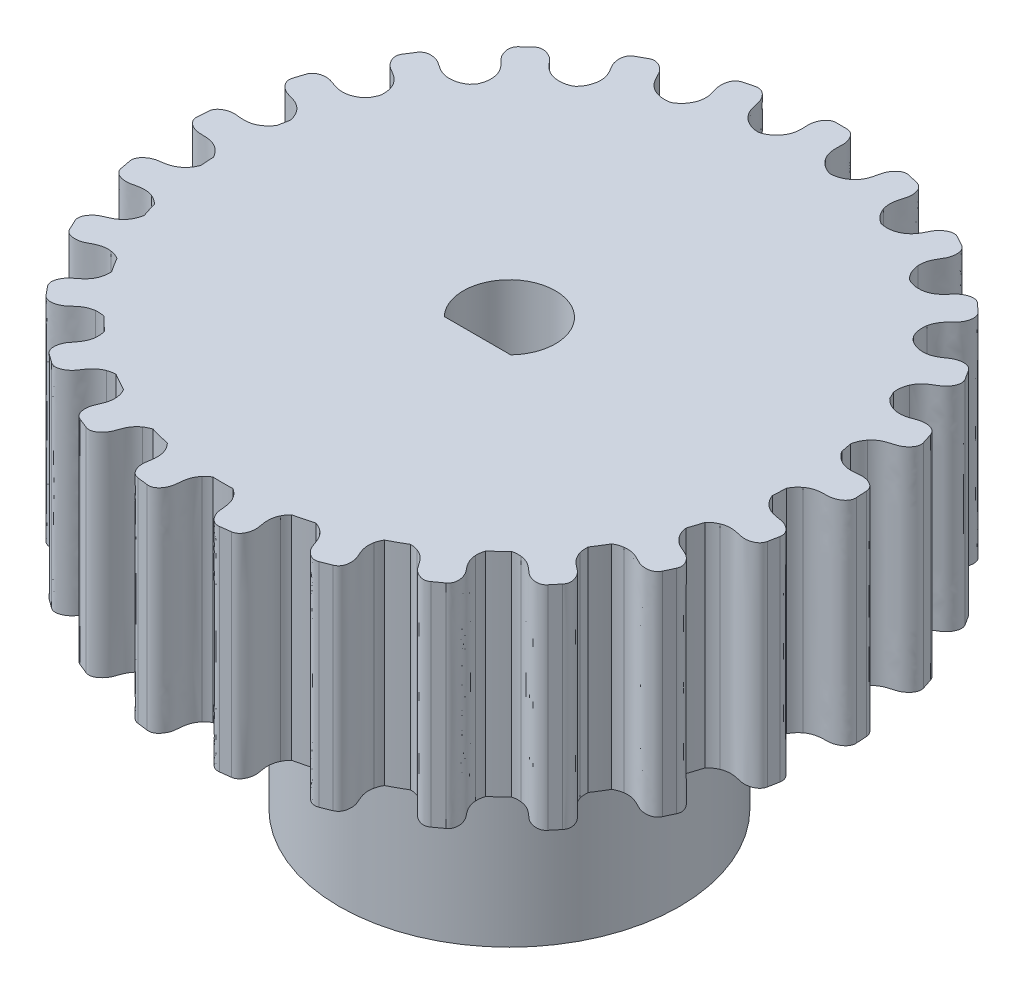
from build123d import *

# Parameters (mm, degrees)
SKETCH1_R           = 17.125
BOSS_EXTRUDE1_DEPTH = 12.7
BOSS_EXTRUDE2_START = -12.7
BOSS_EXTRUDE2_DEPTH = 12.7
CIRPATTERN1_DEPTH   = 12.7
SKETCH3_R           = 10.16
BOSS_EXTRUDE3_DEPTH = 12.7
CUT_EXTRUDE1_DEPTH  = 25.4


# Read off the part's stored shape, not the designer's step: CirPattern1
with BuildPart() as part:
    # Sketch1 → Boss-Extrude1 (new body)
    with BuildSketch(Plane(origin=(0, 0, 0), x_dir=(1, 0, 0), z_dir=(0, 1, 0))):
        with Locations(Location((0, 0, 0), (0, 0, 270))):
            Circle(SKETCH1_R)
    extrude(amount=BOSS_EXTRUDE1_DEPTH)

    # Sketch2 → Boss-Extrude2 (add)
    with BuildSketch(Plane(origin=(0, 12.7, 0), x_dir=(1, 0, 0), z_dir=(0, 1, 0)).offset(BOSS_EXTRUDE2_START)):
        with BuildLine():
            Line((-0.3175, 19.825), (0.3175, 19.825))
            add(Edge.make_bspline(
                [(0.3175, 19.825), (0.607981993, 19.825), (0.89165993, 19.520095158), (1.061805109, 18.955823633), (0.968587789, 18.338125341), (1.094815852, 17.865838386), (1.25, 17.633)],
                knots=[0, 0, 0, 0, 0.24204592, 0.376938714, 0.592012562, 0.861996226, 0.861996226, 0.861996226, 0.861996226], degree=3))
            ThreePointArc((1.25, 17.633), (1.709680567, 17.18632638), (2.312365192, 16.968164079))
            ThreePointArc((2.312365192, 16.968164079), (0, 17.125), (-2.312365192, 16.968164079))
            ThreePointArc((-2.312365192, 16.968164079), (-1.709680567, 17.18632638), (-1.25, 17.633))
            add(Edge.make_bspline(
                [(-0.3175, 19.825), (-0.610981756, 19.825), (-0.890921324, 19.520095158), (-1.062056245, 18.955823633), (-0.96847928, 18.338125341), (-1.094815852, 17.865838386), (-1.25, 17.633)],
                knots=[0, 0, 0, 0, 0.24204592, 0.376938714, 0.592012562, 0.861996226, 0.861996226, 0.861996226, 0.861996226], degree=3))
        make_face()
    extrude(amount=BOSS_EXTRUDE2_DEPTH)

    # CirPattern1 outline → CirPattern1 (add)
    with BuildSketch(Plane(origin=(0, 0, 0), x_dir=(1, 0, 0), z_dir=(0, 1, 0))):
        with BuildLine():
            ThreePointArc((-2.133196695, 17.003626255), (-2.675042221, 17.105543819), (-3.145165664, 17.393584983))
            add(Edge.make_bspline(
                [(-3.145165664, 17.393584983), (-3.353378968, 17.580515595), (-3.593094334, 18.006573144), (-3.656420926, 18.628047513), (-3.961549303, 19.132278025), (-4.312141727, 19.357055886), (-4.593497694, 19.284815952)],
                knots=[0, 0, 0, 0, 0.269983664, 0.485057513, 0.619950306, 0.861996226, 0.861996226, 0.861996226, 0.861996226], degree=3))
            Line((-4.593497694, 19.284815952), (-5.208548001, 19.126897874))
            add(Edge.make_bspline(
                [(-5.208548001, 19.126897874), (-5.492809488, 19.053911929), (-5.688127489, 18.688968094), (-5.71355727, 18.099864672), (-5.469304879, 17.524844153), (-5.474219366, 17.035976333), (-5.566623566, 16.771860265)],
                knots=[0, 0, 0, 0, 0.24204592, 0.376938714, 0.592012562, 0.861996226, 0.861996226, 0.861996226, 0.861996226], degree=3))
            ThreePointArc((-5.566623566, 16.771860265), (-5.839830786, 16.292964416), (-6.265554128, 15.942617366))
            ThreePointArc((-6.265554128, 15.942617366), (-6.815722447, 15.9065815), (-7.342709022, 16.068658375))
            add(Edge.make_bspline(
                [(-7.342709022, 16.068658375), (-7.590868676, 16.197935675), (-7.929009146, 16.550993056), (-8.144900608, 17.137193981), (-8.565839845, 17.549700823), (-8.961317744, 17.680228084), (-9.215869055, 17.540287317)],
                knots=[0, 0, 0, 0, 0.269983664, 0.485057513, 0.619950306, 0.861996226, 0.861996226, 0.861996226, 0.861996226], degree=3))
            Line((-9.215869055, 17.540287317), (-9.772323797, 17.234373734))
            add(Edge.make_bspline(
                [(-9.772323797, 17.234373734), (-10.02950382, 17.09298782), (-10.127927706, 16.690935754), (-10.006054499, 16.114015971), (-9.626473958, 15.617803878), (-9.509657565, 15.143072557), (-9.533475722, 14.86427419)],
                knots=[0, 0, 0, 0, 0.24204592, 0.376938714, 0.592012562, 0.861996226, 0.861996226, 0.861996226, 0.861996226], degree=3))
            ThreePointArc((-9.533475722, 14.86427419), (-9.6659888, 14.360198934), (-9.960605101, 13.930253803))
            ThreePointArc((-9.960605101, 13.930253803), (-6.321682898, 15.915462617), (-2.312365192, 16.968164079))
            ThreePointArc((-2.312365192, 16.968164079), (-2.222249219, 16.98320869), (-2.133196695, 17.003626255))
        make_face()
        with BuildLine():
            ThreePointArc((2.312365192, 16.968164079), (6.321682164, 15.915462909), (9.960603816, 13.930254722))
            ThreePointArc((9.960603816, 13.930254722), (9.665988361, 14.360199402), (9.533475641, 14.864273874))
            add(Edge.make_bspline(
                [(9.533475641, 14.864273874), (9.509657483, 15.143072241), (9.626568965, 15.617751287), (10.005834346, 16.114136641), (10.12857487, 16.690579612), (10.026875026, 17.09443265), (9.772323716, 17.234373418)],
                knots=[0, 0, 0, 0, 0.269983664, 0.485057513, 0.619950306, 0.861996226, 0.861996226, 0.861996226, 0.861996226], degree=3))
            Line((9.772323716, 17.234373418), (9.215868974, 17.540287001))
            add(Edge.make_bspline(
                [(9.215868974, 17.540287001), (8.958688951, 17.681672915), (8.566487009, 17.54934468), (8.144680455, 17.137314651), (7.929104153, 16.550940465), (7.590868595, 16.197935359), (7.342708941, 16.068658059)],
                knots=[0, 0, 0, 0, 0.24204592, 0.376938714, 0.592012562, 0.861996226, 0.861996226, 0.861996226, 0.861996226], degree=3))
            ThreePointArc((7.342708941, 16.068658059), (6.815722682, 15.906581221), (6.265554663, 15.942616894))
            ThreePointArc((6.265554663, 15.942616894), (5.839830971, 16.292964009), (5.566623546, 16.771860101))
            add(Edge.make_bspline(
                [(5.566623546, 16.771860101), (5.474219345, 17.03597617), (5.469409959, 17.524817004), (5.713314003, 18.099926964), (5.68884287, 18.688784246), (5.489903947, 19.054657776), (5.208547981, 19.12689771)],
                knots=[0, 0, 0, 0, 0.269983664, 0.485057513, 0.619950306, 0.861996226, 0.861996226, 0.861996226, 0.861996226], degree=3))
            Line((5.208547981, 19.12689771), (4.593497673, 19.284815789))
            add(Edge.make_bspline(
                [(4.593497673, 19.284815789), (4.309236187, 19.357801733), (3.962264684, 19.132094177), (3.65617766, 18.628109805), (3.593199414, 18.006545995), (3.353378948, 17.580515431), (3.145165643, 17.393584819)],
                knots=[0, 0, 0, 0, 0.24204592, 0.376938714, 0.592012562, 0.861996226, 0.861996226, 0.861996226, 0.861996226], degree=3))
            ThreePointArc((3.145165643, 17.393584819), (2.675042497, 17.10554377), (2.13319731, 17.003626094))
            ThreePointArc((2.13319731, 17.003626094), (2.222249531, 16.983208629), (2.312365192, 16.968164079))
        make_face()
        with BuildLine():
            ThreePointArc((10.061175389, 13.857791122), (11.63148023, 12.568782465), (13.038084403, 11.102881612))
            ThreePointArc((13.038084403, 11.102881612), (12.896645059, 11.555715834), (12.901304379, 12.030101975))
            add(Edge.make_bspline(
                [(12.901304379, 12.030101975), (12.947568847, 12.306064714), (13.178855218, 12.736756142), (13.669651298, 13.123227172), (13.93189124, 13.6510358), (13.93382065, 14.067492775), (13.722068391, 14.266341383)],
                knots=[0, 0, 0, 0, 0.269983664, 0.485057513, 0.619950306, 0.861996226, 0.861996226, 0.861996226, 0.861996226], degree=3))
            Line((13.722068391, 14.266341383), (13.259173312, 14.701028795))
            add(Edge.make_bspline(
                [(13.259173312, 14.701028795), (13.045234319, 14.901930882), (12.632445429, 14.871296639), (12.121423002, 14.577110315), (11.766794096, 14.062769798), (11.35139603, 13.80497076), (11.078882811, 13.74146974)],
                knots=[0, 0, 0, 0, 0.24204592, 0.376938714, 0.592012562, 0.861996226, 0.861996226, 0.861996226, 0.861996226], degree=3))
            ThreePointArc((11.078882811, 13.74146974), (10.559963423, 13.711564817), (10.061175389, 13.857791122))
        make_face()
        with BuildLine():
            ThreePointArc((13.239263858, 10.862205923), (14.384473987, 9.292606368), (15.344515696, 7.603384974))
            ThreePointArc((15.344515696, 7.603384974), (15.34134542, 8.033529646), (15.458496695, 8.44742585))
            add(Edge.make_bspline(
                [(15.458496695, 8.44742585), (15.571936822, 8.703213206), (15.903065509, 9.062855089), (16.474553764, 9.3151284), (16.859815624, 9.761138528), (16.965253057, 10.164031917), (16.809605022, 10.409293975)],
                knots=[0, 0, 0, 0, 0.269983664, 0.485057513, 0.619950306, 0.861996226, 0.861996226, 0.861996226, 0.861996226], degree=3))
            Line((16.809605022, 10.409293975), (16.469355007, 10.945442208))
            add(Edge.make_bspline(
                [(16.469355007, 10.945442208), (16.312099618, 11.19323705), (15.904660824, 11.26622166), (15.336531942, 11.10836385), (14.86513307, 10.698374909), (14.398673484, 10.5519804), (14.118929708, 10.558245664)],
                knots=[0, 0, 0, 0, 0.24204592, 0.376938714, 0.592012562, 0.861996226, 0.861996226, 0.861996226, 0.861996226], degree=3))
            ThreePointArc((14.118929708, 10.558245664), (13.655325725, 10.641431971), (13.239263858, 10.862205923))
        make_face()
        with BuildLine():
            ThreePointArc((15.555546224, 7.161746062), (16.241216742, 5.430331825), (16.734830812, 3.634702558))
            ThreePointArc((16.734830812, 3.634702558), (16.84414735, 4.007941727), (17.044374791, 4.341358214))
            add(Edge.make_bspline(
                [(17.044374791, 4.341358214), (17.217862716, 4.560898128), (17.628027686, 4.826892845), (18.244299408, 4.929117175), (18.728375767, 5.265304346), (18.9306962, 5.629318875), (18.840932327, 5.905583667)],
                knots=[0, 0, 0, 0, 0.269983664, 0.485057513, 0.619950306, 0.861996226, 0.861996226, 0.861996226, 0.861996226], degree=3))
            Line((18.840932327, 5.905583667), (18.644706536, 6.509504555))
            add(Edge.make_bspline(
                [(18.644706536, 6.509504555), (18.554015686, 6.788622291), (18.177527865, 6.960639864), (17.587990156, 6.949029355), (17.029441043, 6.669153103), (16.541229309, 6.643361628), (16.271832305, 6.718999505)],
                knots=[0, 0, 0, 0, 0.24204592, 0.376938714, 0.592012562, 0.861996226, 0.861996226, 0.861996226, 0.861996226], degree=3))
            ThreePointArc((16.271832305, 6.718999505), (15.882502828, 6.889918612), (15.555546224, 7.161746062))
        make_face()
        with BuildLine():
            ThreePointArc((16.860605941, 2.997597754), (17.081410447, 1.221082366), (17.115551932, -0.568776821))
            ThreePointArc((17.115551932, -0.568776821), (17.306171434, -0.273696163), (17.559292113, -0.0301016))
            add(Edge.make_bspline(
                [(17.559292113, -0.0301016), (17.781926953, 0.13939637), (18.245356032, 0.295030494), (18.867688601, 0.240782714), (19.420163161, 0.446023052), (19.706654057, 0.74828635), (19.688414542, 1.038195143)],
                knots=[0, 0, 0, 0, 0.269983664, 0.485057513, 0.619950306, 0.861996226, 0.861996226, 0.861996226, 0.861996226], degree=3))
            Line((19.688414542, 1.038195143), (19.648542562, 1.671942115))
            add(Edge.make_bspline(
                [(19.648542562, 1.671942115), (19.63011469, 1.964844752), (19.308233958, 2.22508679), (18.734330243, 2.360453112), (18.123726584, 2.228275203), (17.64443884, 2.324707336), (17.402315814, 2.464965221)],
                knots=[0, 0, 0, 0, 0.24204592, 0.376938714, 0.592012562, 0.861996226, 0.861996226, 0.861996226, 0.861996226], degree=3))
            ThreePointArc((17.402315814, 2.464965221), (17.097739623, 2.696985541), (16.860605941, 2.997597754))
        make_face()
        with BuildLine():
            ThreePointArc((17.070991058, -1.359003049), (16.847212798, -3.071977529), (16.451992286, -4.753690652))
            ThreePointArc((16.451992286, -4.753690652), (16.692491971, -4.545774899), (16.970894512, -4.392278697))
            add(Edge.make_bspline(
                [(16.970894512, -4.392278697), (17.2286873, -4.28347285), (17.716261535, -4.247978384), (18.305551509, -4.455289686), (18.89171026, -4.393892187), (19.244370344, -4.172372436), (19.298801242, -3.887035678)],
                knots=[0, 0, 0, 0, 0.269983664, 0.485057513, 0.619950306, 0.861996226, 0.861996226, 0.861996226, 0.861996226], degree=3))
            Line((19.298801242, -3.887035678), (19.417788377, -3.263283273))
            add(Edge.make_bspline(
                [(19.417788377, -3.263283273), (19.472781374, -2.974999886), (19.225732679, -2.642885347), (18.703523441, -2.369047757), (18.079231709, -2.345222098), (17.638983368, -2.132625544), (17.439347799, -1.936560571)],
                knots=[0, 0, 0, 0, 0.24204592, 0.376938714, 0.592012562, 0.861996226, 0.861996226, 0.861996226, 0.861996226], degree=3))
            ThreePointArc((17.439347799, -1.936560571), (17.22229806, -1.668746631), (17.070991058, -1.359003049))
        make_face()
        with BuildLine():
            ThreePointArc((16.174934263, -5.624689021), (15.548144412, -7.177801219), (14.772639883, -8.662259282))
            ThreePointArc((14.772639883, -8.662259282), (15.035279882, -8.540751989), (15.316153174, -8.471081446))
            add(Edge.make_bspline(
                [(15.316153174, -8.471081446), (15.592905842, -8.429804394), (16.07398915, -8.516679834), (16.593209271, -8.864028527), (17.176221705, -8.950331697), (17.572892046, -8.823474392), (17.696573263, -8.560638427)],
                knots=[0, 0, 0, 0, 0.269983664, 0.485057513, 0.619950306, 0.861996226, 0.861996226, 0.861996226, 0.861996226], degree=3))
            Line((17.696573263, -8.560638427), (17.966943113, -7.986073249))
            add(Edge.make_bspline(
                [(17.966943113, -7.986073249), (18.091901567, -7.720523017), (17.935207889, -7.337403955), (17.497505453, -6.942301319), (16.898752195, -6.763969147), (16.525205677, -6.448566394), (16.380601403, -6.209013815)],
                knots=[0, 0, 0, 0, 0.24204592, 0.376938714, 0.592012562, 0.861996226, 0.861996226, 0.861996226, 0.861996226], degree=3))
            ThreePointArc((16.380601403, -6.209013815), (16.247765815, -5.927411348), (16.174934263, -5.624689021))
        make_face()
        with BuildLine():
            ThreePointArc((14.233148824, -9.522767431), (13.261769633, -10.834716942), (12.169885972, -12.048215653))
            ThreePointArc((12.169885972, -12.048215653), (12.432797896, -12.006017119), (12.699041583, -12.01022367))
            add(Edge.make_bspline(
                [(12.699041583, -12.01022367), (12.977364742, -12.039069002), (13.42172889, -12.242855643), (13.838254649, -12.708416532), (14.381487949, -12.936997626), (14.797244291, -12.912773679), (14.982404481, -12.688953457)],
                knots=[0, 0, 0, 0, 0.269983664, 0.485057513, 0.619950306, 0.861996226, 0.861996226, 0.861996226, 0.861996226], degree=3))
            Line((14.982404481, -12.688953457), (15.387168715, -12.199677548))
            add(Edge.make_bspline(
                [(15.387168715, -12.199677548), (15.574241027, -11.973545968), (15.517748005, -11.563495163), (15.192054826, -11.071953234), (14.65646191, -10.750319815), (14.373088518, -10.351928777), (14.292601557, -10.083940563)],
                knots=[0, 0, 0, 0, 0.24204592, 0.376938714, 0.592012562, 0.861996226, 0.861996226, 0.861996226, 0.861996226], degree=3))
            ThreePointArc((14.292601557, -10.083940563), (14.23667449, -9.806129795), (14.233148824, -9.522767431))
        make_face()
        with BuildLine():
            ThreePointArc((11.374681213, -12.801650374), (10.129847128, -13.807672583), (8.79652823, -14.693083955))
            ThreePointArc((8.79652823, -14.693083955), (9.044129109, -14.72022088), (9.284002484, -14.787328046))
            add(Edge.make_bspline(
                [(9.284002484, -14.787328046), (9.546408067, -14.884483304), (9.926132022, -15.192376483), (10.213791573, -15.746896665), (10.683112394, -16.103393091), (11.091831236, -16.183324582), (11.326836105, -16.01258355)],
                knots=[0, 0, 0, 0, 0.269983664, 0.485057513, 0.619950306, 0.861996226, 0.861996226, 0.861996226, 0.861996226], degree=3))
            Line((11.326836105, -16.01258355), (11.840561896, -15.639339915))
            add(Edge.make_bspline(
                [(11.840561896, -15.639339915), (12.077993624, -15.466835667), (12.125250923, -15.055618119), (11.932031501, -14.498522283), (11.4932522, -14.053797028), (11.317857327, -13.597450081), (11.30654497, -13.317864916)],
                knots=[0, 0, 0, 0, 0.24204592, 0.376938714, 0.592012562, 0.861996226, 0.861996226, 0.861996226, 0.861996226], degree=3))
            ThreePointArc((11.30654497, -13.317864916), (11.318403538, -13.056826159), (11.374681213, -12.801650374))
        make_face()
        with BuildLine():
            ThreePointArc((7.788053546, -15.251617847), (6.349947316, -15.904206805), (4.857839163, -16.421541452))
            ThreePointArc((4.857839163, -16.421541452), (5.079815457, -16.507953437), (5.285615345, -16.627898894))
            add(Edge.make_bspline(
                [(5.285615345, -16.627898894), (5.515615444, -16.787259455), (5.806839752, -17.179913112), (5.947558388, -17.788550043), (6.313477577, -18.25056182), (6.689477611, -18.429626359), (6.959560938, -18.322692805)],
                knots=[0, 0, 0, 0, 0.269983664, 0.485057513, 0.619950306, 0.861996226, 0.861996226, 0.861996226, 0.861996226], degree=3))
            Line((6.959560938, -18.322692805), (7.549969006, -18.088933714))
            add(Edge.make_bspline(
                [(7.549969006, -18.088933714), (7.822841442, -17.980895874), (7.970879711, -17.594349894), (7.922274734, -17.006704532), (7.607879164, -16.466831163), (7.551483515, -15.981202264), (7.61005656, -15.707587512)],
                knots=[0, 0, 0, 0, 0.24204592, 0.376938714, 0.592012562, 0.861996226, 0.861996226, 0.861996226, 0.861996226], degree=3))
            ThreePointArc((7.61005656, -15.707587512), (7.680629353, -15.472409835), (7.788053546, -15.251617847))
        make_face()
        with BuildLine():
            ThreePointArc((3.70826386, -16.718684283), (2.162927746, -16.987859446), (0.599444518, -17.114505288))
            ThreePointArc((0.599444518, -17.114505288), (0.788893089, -17.251707889), (0.955113534, -17.416286377))
            add(Edge.make_bspline(
                [(0.955113534, -17.416286377), (1.138256396, -17.627839032), (1.322682364, -18.080581292), (1.307618215, -18.705092077), (1.547143723, -19.243589306), (1.866799485, -19.510535609), (2.154990941, -19.474128562)],
                knots=[0, 0, 0, 0, 0.269983664, 0.485057513, 0.619950306, 0.861996226, 0.861996226, 0.861996226, 0.861996226], degree=3))
            Line((2.154990941, -19.474128562), (2.784983776, -19.394541959))
            add(Edge.make_bspline(
                [(2.784983776, -19.394541959), (3.07615134, -19.357758941), (3.315668792, -19.020172634), (3.414732288, -18.438901666), (3.244475081, -17.837802413), (3.3106222, -17.35340541), (3.435400287, -17.102953293)],
                knots=[0, 0, 0, 0, 0.24204592, 0.376938714, 0.592012562, 0.861996226, 0.861996226, 0.861996226, 0.861996226], degree=3))
            ThreePointArc((3.435400287, -17.102953293), (3.556887934, -16.900207182), (3.70826386, -16.718684283))
        make_face()
        with BuildLine():
            ThreePointArc((-0.599445882, -17.114505241), (-2.162929219, -16.987859259), (-3.708265426, -16.718683935))
            ThreePointArc((-3.708265426, -16.718683935), (-3.556889348, -16.900206948), (-3.435401594, -17.102953211))
            add(Edge.make_bspline(
                [(-3.435401594, -17.102953211), (-3.310623507, -17.353405328), (-3.244584042, -17.83778873), (-3.414484439, -18.438933059), (-3.316402881, -19.020079979), (-3.073176539, -19.358134829), (-2.784985083, -19.394541876)],
                knots=[0, 0, 0, 0, 0.269983664, 0.485057513, 0.619950306, 0.861996226, 0.861996226, 0.861996226, 0.861996226], degree=3))
            Line((-2.784985083, -19.394541876), (-2.154992248, -19.47412848))
            add(Edge.make_bspline(
                [(-2.154992248, -19.47412848), (-1.863824683, -19.510911497), (-1.547877813, -19.243496652), (-1.307370367, -18.70512347), (-1.322791326, -18.08056761), (-1.138257704, -17.62783895), (-0.955114841, -17.416286295)],
                knots=[0, 0, 0, 0, 0.24204592, 0.376938714, 0.592012562, 0.861996226, 0.861996226, 0.861996226, 0.861996226], degree=3))
            ThreePointArc((-0.955114841, -17.416286295), (-0.788894422, -17.251707829), (-0.599445882, -17.114505241))
        make_face()
        with BuildLine():
            ThreePointArc((-4.857840207, -16.421541143), (-6.34994866, -15.904206268), (-7.788055155, -15.251617026))
            ThreePointArc((-7.788055155, -15.251617026), (-7.680630741, -15.472409279), (-7.610057826, -15.70758727))
            add(Edge.make_bspline(
                [(-7.610057826, -15.70758727), (-7.551484781, -15.981202022), (-7.607981321, -16.466790977), (-7.9220425, -17.00679674), (-7.971567716, -17.594077753), (-7.820053599, -17.981999919), (-7.549970272, -18.088933473)],
                knots=[0, 0, 0, 0, 0.269983664, 0.485057513, 0.619950306, 0.861996226, 0.861996226, 0.861996226, 0.861996226], degree=3))
            Line((-7.549970272, -18.088933473), (-6.959562204, -18.322692564))
            add(Edge.make_bspline(
                [(-6.959562204, -18.322692564), (-6.686689768, -18.430730404), (-6.314165582, -18.25028968), (-5.947326154, -17.788642251), (-5.806941908, -17.179872925), (-5.51561671, -16.787259214), (-5.285616611, -16.627898652)],
                knots=[0, 0, 0, 0, 0.24204592, 0.376938714, 0.592012562, 0.861996226, 0.861996226, 0.861996226, 0.861996226], degree=3))
            ThreePointArc((-5.285616611, -16.627898652), (-5.079816619, -16.507953144), (-4.857840207, -16.421541143))
        make_face()
        with BuildLine():
            ThreePointArc((-8.796528898, -14.693083555), (-10.129848238, -13.807671768), (-11.374682689, -12.801649062))
            ThreePointArc((-11.374682689, -12.801649062), (-11.318404789, -13.056825293), (-11.306546157, -13.31786453))
            add(Edge.make_bspline(
                [(-11.306546157, -13.31786453), (-11.317858514, -13.597449695), (-11.493341173, -14.053732861), (-11.931829515, -14.498669511), (-12.125849655, -15.055183591), (-12.075567952, -15.468598498), (-11.840563083, -15.639339529)],
                knots=[0, 0, 0, 0, 0.269983664, 0.485057513, 0.619950306, 0.861996226, 0.861996226, 0.861996226, 0.861996226], degree=3))
            Line((-11.840563083, -15.639339529), (-11.326837292, -16.012583164))
            add(Edge.make_bspline(
                [(-11.326837292, -16.012583164), (-11.089405564, -16.185087412), (-10.683711126, -16.102958563), (-10.213589587, -15.747043893), (-9.926220995, -15.192312317), (-9.546409254, -14.884482918), (-9.284003671, -14.787327661)],
                knots=[0, 0, 0, 0, 0.24204592, 0.376938714, 0.592012562, 0.861996226, 0.861996226, 0.861996226, 0.861996226], degree=3))
            ThreePointArc((-9.284003671, -14.787327661), (-9.044130041, -14.720220445), (-8.796528898, -14.693083555))
        make_face()
        with BuildLine():
            ThreePointArc((-12.169886282, -12.04821534), (-13.261770441, -10.834715952), (-14.23315, -9.522765674))
            ThreePointArc((-14.23315, -9.522765674), (-14.236675499, -9.806128665), (-14.292602632, -10.083940057))
            add(Edge.make_bspline(
                [(-14.292602632, -10.083940057), (-14.373089593, -10.351928272), (-14.656532151, -10.750235701), (-15.191895821, -11.072146232), (-15.518219885, -11.562925551), (-15.57232998, -11.97585682), (-15.387169789, -12.199677042)],
                knots=[0, 0, 0, 0, 0.269983664, 0.485057513, 0.619950306, 0.861996226, 0.861996226, 0.861996226, 0.861996226], degree=3))
            Line((-15.387169789, -12.199677042), (-14.982405556, -12.688952951))
            add(Edge.make_bspline(
                [(-14.982405556, -12.688952951), (-14.795333244, -12.91508453), (-14.381959829, -12.936428014), (-13.838095643, -12.70860953), (-13.421799132, -12.24277153), (-12.977365816, -12.039068496), (-12.699042657, -12.010223164)],
                knots=[0, 0, 0, 0, 0.24204592, 0.376938714, 0.592012562, 0.861996226, 0.861996226, 0.861996226, 0.861996226], degree=3))
            ThreePointArc((-12.699042657, -12.010223164), (-12.432798577, -12.006016641), (-12.169886282, -12.04821534))
        make_face()
        with BuildLine():
            ThreePointArc((-14.772639926, -8.66225921), (-15.548144897, -7.177800169), (-16.174934995, -5.624686915))
            ThreePointArc((-16.174934995, -5.624686915), (-16.247766498, -5.927410035), (-16.380602339, -6.209013221))
            add(Edge.make_bspline(
                [(-16.380602339, -6.209013221), (-16.525206613, -6.4485658), (-16.898799331, -6.763870371), (-17.497399461, -6.94252796), (-17.935523307, -7.33673505), (-18.090625266, -7.72323669), (-17.966944048, -7.986072655)],
                knots=[0, 0, 0, 0, 0.269983664, 0.485057513, 0.619950306, 0.861996226, 0.861996226, 0.861996226, 0.861996226], degree=3))
            Line((-17.966944048, -7.986072655), (-17.696574198, -8.560637833))
            add(Edge.make_bspline(
                [(-17.696574198, -8.560637833), (-17.571615744, -8.826188065), (-17.176537124, -8.949662792), (-16.593103278, -8.864255168), (-16.074036287, -8.516581057), (-15.592906777, -8.4298038), (-15.31615411, -8.471080853)],
                knots=[0, 0, 0, 0, 0.24204592, 0.376938714, 0.592012562, 0.861996226, 0.861996226, 0.861996226, 0.861996226], degree=3))
            ThreePointArc((-15.31615411, -8.471080853), (-15.035280329, -8.540751566), (-14.772639926, -8.66225921))
        make_face()
        with BuildLine():
            ThreePointArc((-16.451992208, -4.753690921), (-16.847212981, -3.071976522), (-17.070991243, -1.359000729))
            ThreePointArc((-17.070991243, -1.359000729), (-17.222298361, -1.668745237), (-17.439348578, -1.936559926))
            add(Edge.make_bspline(
                [(-17.439348578, -1.936559926), (-17.638984147, -2.132624899), (-18.079252821, -2.345114866), (-18.703477162, -2.3692938), (-19.225871859, -2.642159179), (-19.472220053, -2.977945871), (-19.417789156, -3.263282629)],
                knots=[0, 0, 0, 0, 0.269983664, 0.485057513, 0.619950306, 0.861996226, 0.861996226, 0.861996226, 0.861996226], degree=3))
            Line((-19.417789156, -3.263282629), (-19.298802021, -3.887035033))
            add(Edge.make_bspline(
                [(-19.298802021, -3.887035033), (-19.243809024, -4.17531842), (-18.891849441, -4.393166019), (-18.30550523, -4.455535729), (-17.716282647, -4.247871152), (-17.22868808, -4.283472205), (-16.970895292, -4.392278053)],
                knots=[0, 0, 0, 0, 0.24204592, 0.376938714, 0.592012562, 0.861996226, 0.861996226, 0.861996226, 0.861996226], degree=3))
            ThreePointArc((-16.970895292, -4.392278053), (-16.692492236, -4.545774612), (-16.451992208, -4.753690921))
        make_face()
        with BuildLine():
            ThreePointArc((-17.115551911, -0.568777457), (-17.081410383, 1.221083254), (-16.860605518, 2.997600133))
            ThreePointArc((-16.860605518, 2.997600133), (-17.09773952, 2.696986901), (-17.402316429, 2.464965876))
            add(Edge.make_bspline(
                [(-17.402316429, 2.464965876), (-17.644439455, 2.324707991), (-18.123720386, 2.228384154), (-18.734346627, 2.360203127), (-19.308188195, 2.225824594), (-19.630303662, 1.961851563), (-19.648543177, 1.67194277)],
                knots=[0, 0, 0, 0, 0.269983664, 0.485057513, 0.619950306, 0.861996226, 0.861996226, 0.861996226, 0.861996226], degree=3))
            Line((-19.648543177, 1.67194277), (-19.688415157, 1.038195798))
            add(Edge.make_bspline(
                [(-19.688415157, 1.038195798), (-19.706843029, 0.745293161), (-19.420117398, 0.446760856), (-18.867704985, 0.240532729), (-18.245349833, 0.295139445), (-17.781927568, 0.139397025), (-17.559292728, -0.030100946)],
                knots=[0, 0, 0, 0, 0.24204592, 0.376938714, 0.592012562, 0.861996226, 0.861996226, 0.861996226, 0.861996226], degree=3))
            ThreePointArc((-17.559292728, -0.030100946), (-17.306171591, -0.273696063), (-17.115551911, -0.568777457))
        make_face()
        with BuildLine():
            ThreePointArc((-16.734831017, 3.634701614), (-16.241216498, 5.430332557), (-15.555545176, 7.16174834))
            ThreePointArc((-15.555545176, 7.16174834), (-15.882502331, 6.889919824), (-16.271832758, 6.719000129))
            add(Edge.make_bspline(
                [(-16.271832758, 6.719000129), (-16.541229762, 6.643362252), (-17.029407965, 6.669256926), (-17.588068215, 6.948791135), (-18.177300077, 6.961342945), (-18.554943117, 6.785769971), (-18.644706989, 6.509505179)],
                knots=[0, 0, 0, 0, 0.269983664, 0.485057513, 0.619950306, 0.861996226, 0.861996226, 0.861996226, 0.861996226], degree=3))
            Line((-18.644706989, 6.509505179), (-18.840932781, 5.905584292))
            add(Edge.make_bspline(
                [(-18.840932781, 5.905584292), (-18.931623631, 5.626466555), (-18.728147978, 5.266007427), (-18.244377466, 4.928878955), (-17.627994608, 4.826996668), (-17.21786317, 4.560898752), (-17.044375244, 4.341358838)],
                knots=[0, 0, 0, 0, 0.24204592, 0.376938714, 0.592012562, 0.861996226, 0.861996226, 0.861996226, 0.861996226], degree=3))
            ThreePointArc((-17.044375244, 4.341358838), (-16.844147485, 4.007941623), (-16.734831017, 3.634701614))
        make_face()
        with BuildLine():
            ThreePointArc((-15.344516252, 7.603383851), (-14.384473614, 9.292606945), (-13.239262192, 10.862207953))
            ThreePointArc((-13.239262192, 10.862207953), (-13.655324866, 10.641432927), (-14.118930013, 10.558246218))
            add(Edge.make_bspline(
                [(-14.118930013, 10.558246218), (-14.398673789, 10.551980954), (-14.865075232, 10.698467081), (-15.336666812, 11.108152363), (-15.904265364, 11.26684584), (-16.313707276, 11.19070482), (-16.469355312, 10.945442762)],
                knots=[0, 0, 0, 0, 0.269983664, 0.485057513, 0.619950306, 0.861996226, 0.861996226, 0.861996226, 0.861996226], degree=3))
            Line((-16.469355312, 10.945442762), (-16.809605326, 10.409294529))
            add(Edge.make_bspline(
                [(-16.809605326, 10.409294529), (-16.966860715, 10.161499687), (-16.859420164, 9.761762708), (-16.474688634, 9.314916913), (-15.903007671, 9.062947261), (-15.571937127, 8.70321376), (-15.458497, 8.447426404)],
                knots=[0, 0, 0, 0, 0.24204592, 0.376938714, 0.592012562, 0.861996226, 0.861996226, 0.861996226, 0.861996226], degree=3))
            ThreePointArc((-15.458497, 8.447426404), (-15.341345611, 8.033529359), (-15.344516252, 7.603383851))
        make_face()
        with BuildLine():
            ThreePointArc((-13.038085356, 11.102880493), (-11.631479733, 12.568782925), (-10.061173105, 13.857792781))
            ThreePointArc((-10.061173105, 13.857792781), (-10.559962239, 13.711565422), (-11.078882989, 13.741470189))
            add(Edge.make_bspline(
                [(-11.078882989, 13.741470189), (-11.351396208, 13.804971209), (-11.766715173, 14.062844527), (-12.12160625, 14.57693885), (-12.631907186, 14.871802699), (-13.04742123, 14.899877852), (-13.25917349, 14.701029244)],
                knots=[0, 0, 0, 0, 0.269983664, 0.485057513, 0.619950306, 0.861996226, 0.861996226, 0.861996226, 0.861996226], degree=3))
            Line((-13.25917349, 14.701029244), (-13.722068568, 14.266341832))
            add(Edge.make_bspline(
                [(-13.722068568, 14.266341832), (-13.936007561, 14.065439746), (-13.931352997, 13.65154186), (-13.669834546, 13.123055707), (-13.178776296, 12.736830871), (-12.947569025, 12.306065163), (-12.901304557, 12.030102425)],
                knots=[0, 0, 0, 0, 0.24204592, 0.376938714, 0.592012562, 0.861996226, 0.861996226, 0.861996226, 0.861996226], degree=3))
            ThreePointArc((-12.901304557, 12.030102425), (-12.896645365, 11.555715418), (-13.038085356, 11.102880493))
        make_face()
    extrude(amount=CIRPATTERN1_DEPTH)

    # Sketch3 → Boss-Extrude3 (add)
    with BuildSketch(Plane.XZ):
        with Locations(Location((0, 0, 0), (0, 0, 90))):
            Circle(SKETCH3_R)
    extrude(amount=BOSS_EXTRUDE3_DEPTH)

    # Sketch5 → Cut-Extrude1 (cut)
    with BuildSketch(Plane.XZ.offset(12.7)):
        with BuildLine():
            Line((-1.983299019, 1.905), (1.983299019, 1.905))
            ThreePointArc((1.983299019, 1.905), (0, -2.75), (-1.983299019, 1.905))
        make_face()
    extrude(amount=-CUT_EXTRUDE1_DEPTH, mode=Mode.SUBTRACT)


solid = part.part
